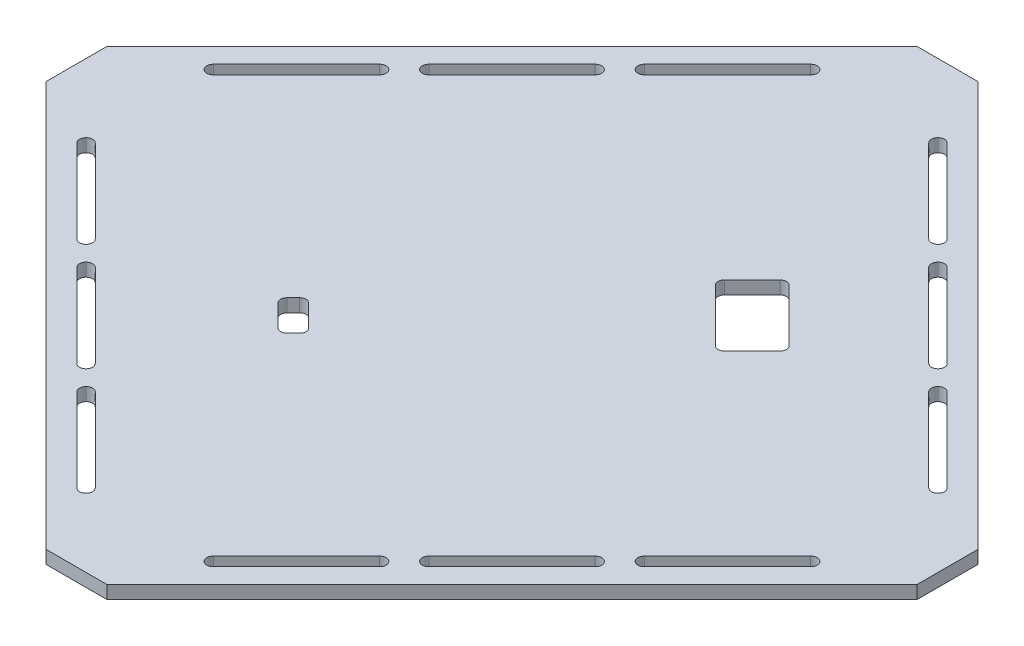
from build123d import *

# Parameters (mm, degrees)
MAIN_PLATE_DEPTH               = 3
BOTTOM_PLATE_CONNECTORS_DEPTH  = 22
REMOVE_STRESS_CONCENTRATIONS_R = 2.5
WIRE_HOLES_DEPTH               = 144.122325303
CUT_EXTRUDE1_DEPTH             = 144.614066163
FILLET1_R                      = 1.5


with BuildPart() as part:
    # Sketch1 → Main Plate (new body)
    with BuildSketch(Plane(origin=(0, 0, 0), x_dir=(1, 0, 0), z_dir=(0, 1, 0))):
        Polygon((-7, 100), (7, 100), (100, 7), (100, -7), (7, -100), (-7, -100), (-100, -7), (-100, 7), align=None)
    extrude(amount=MAIN_PLATE_DEPTH)

    # Sketch2 → Bottom Plate Connectors (add)
    with BuildSketch(Plane.XZ):
        Polygon((7.778174593, 16.970562748), (16.970562748, 7.778174593), (19.091883092, 9.899494937), (9.899494937, 19.091883092), align=None)
        Polygon((16.970562748, -7.778174593), (7.778174593, -16.970562748), (9.899494937, -19.091883092), (19.091883092, -9.899494937), align=None)
        Polygon((-7.778174593, -16.970562748), (-16.970562748, -7.778174593), (-19.091883092, -9.899494937), (-9.899494937, -19.091883092), align=None)
        Polygon((-16.970562748, 7.778174593), (-7.778174593, 16.970562748), (-9.899494937, 19.091883092), (-19.091883092, 9.899494937), align=None)
    extrude(amount=BOTTOM_PLATE_CONNECTORS_DEPTH)

    # Remove Stress Concentrations
    remove_stress_concentrations_edges = [part.edges().sort_by_distance(p)[0] for p in [
        (8.838834765, 0, 18.03122292),
        (18.03122292, 0, 8.838834765),
        (14.495689014, 0, 14.495689014),
        (18.03122292, 0, -8.838834765),
        (8.838834765, 0, -18.03122292),
        (14.495689014, 0, -14.495689014),
        (-8.838834765, 0, -18.03122292),
        (-18.03122292, 0, -8.838834765),
        (-14.495689014, 0, -14.495689014),
        (-18.03122292, 0, 8.838834765),
        (-8.838834765, 0, 18.03122292),
        (-14.495689014, 0, 14.495689014),
    ]]
    fillet(remove_stress_concentrations_edges, radius=REMOVE_STRESS_CONCENTRATIONS_R)

    # Sketch3 → Wire Holes (cut, through all)
    with BuildSketch(Plane.XZ):
        Polygon((30.405591591, -16.263455967), (38.890872965, -24.748737342), (24.748737342, -38.890872965), (16.263455967, -30.405591591), align=None)
        Polygon((-23.334523779, 30.405591591), (-19.798989873, 26.870057685), (-26.870057685, 19.798989873), (-30.405591591, 23.334523779), align=None)
    extrude(amount=-WIRE_HOLES_DEPTH, mode=Mode.SUBTRACT)

    # Sketch4 → Cut-Extrude1 (cut, through all)
    with BuildSketch(Plane(origin=(0, 3, 0), x_dir=(1, 0, 0), z_dir=(0, 1, 0))):
        Polygon((14.609127035, 85.319805153), (35.82233047, 64.106601718), (33.701010127, 61.985281374), (12.487806691, 83.19848481), align=None)
        Polygon((39.357864376, 60.571067812), (60.571067812, 39.357864376), (58.449747468, 37.236544033), (37.236544033, 58.449747468), align=None)
        Polygon((64.106601718, 35.82233047), (85.319805153, 14.609127035), (83.19848481, 12.487806691), (61.985281374, 33.701010127), align=None)
        Polygon((85.319805153, -14.609127035), (64.106601718, -35.82233047), (61.985281374, -33.701010127), (83.19848481, -12.487806691), align=None)
        Polygon((58.449747468, -37.236544033), (60.571067812, -39.357864376), (39.357864376, -60.571067812), (37.236544033, -58.449747468), align=None)
        Polygon((33.701010127, -61.985281374), (35.82233047, -64.106601718), (14.609127035, -85.319805153), (12.487806691, -83.19848481), align=None)
        Polygon((-14.609127035, -85.319805153), (-35.82233047, -64.106601718), (-33.701010127, -61.985281374), (-12.487806691, -83.19848481), align=None)
        Polygon((-37.236544033, -58.449747468), (-39.357864376, -60.571067812), (-60.571067812, -39.357864376), (-58.449747468, -37.236544033), align=None)
        Polygon((-61.985281374, -33.701010127), (-64.106601718, -35.82233047), (-85.319805153, -14.609127035), (-83.19848481, -12.487806691), align=None)
        Polygon((-85.319805153, 14.609127035), (-64.106601718, 35.82233047), (-61.985281374, 33.701010127), (-83.19848481, 12.487806691), align=None)
        Polygon((-58.449747468, 37.236544033), (-60.571067812, 39.357864376), (-39.357864376, 60.571067812), (-37.236544033, 58.449747468), align=None)
        Polygon((-33.701010127, 61.985281374), (-35.82233047, 64.106601718), (-14.609127035, 85.319805153), (-12.487806691, 83.19848481), align=None)
    extrude(amount=-CUT_EXTRUDE1_DEPTH, mode=Mode.SUBTRACT)

    # Fillet1
    fillet1_edges = [part.edges().sort_by_distance(p)[0] for p in [
        (16.263455967, 1.5, -30.405591591),
        (24.748737342, 1.5, -38.890872965),
        (30.405591591, 1.5, -16.263455967),
        (38.890872965, 1.5, -24.748737342),
        (-23.334523779, 1.5, 30.405591591),
        (-19.798989873, 1.5, 26.870057685),
        (-30.405591591, 1.5, 23.334523779),
        (-26.870057685, 1.5, 19.798989873),
        (-33.701010127, 1.5, 61.985281374),
        (-58.449747468, 1.5, 37.236544033),
        (-83.19848481, 1.5, 12.487806691),
        (-64.106601718, 1.5, -35.82233047),
        (-39.357864376, 1.5, -60.571067812),
        (-14.609127035, 1.5, -85.319805153),
        (14.609127035, 1.5, -85.319805153),
        (33.701010127, 1.5, 61.985281374),
        (58.449747468, 1.5, 37.236544033),
        (83.19848481, 1.5, 12.487806691),
        (39.357864376, 1.5, -60.571067812),
        (64.106601718, 1.5, -35.82233047),
        (-39.357864376, 1.5, 60.571067812),
        (-64.106601718, 1.5, 35.82233047),
        (-83.19848481, 1.5, -12.487806691),
        (-58.449747468, 1.5, -37.236544033),
        (-33.701010127, 1.5, -61.985281374),
        (33.701010127, 1.5, -61.985281374),
        (58.449747468, 1.5, -37.236544033),
        (83.19848481, 1.5, -12.487806691),
        (64.106601718, 1.5, 35.82233047),
        (-14.609127035, 1.5, 85.319805153),
        (39.357864376, 1.5, 60.571067812),
        (14.609127035, 1.5, 85.319805153),
        (-85.319805153, 1.5, 14.609127035),
        (-85.319805153, 1.5, -14.609127035),
        (-60.571067812, 1.5, -39.357864376),
        (-35.82233047, 1.5, -64.106601718),
        (-60.571067812, 1.5, 39.357864376),
        (-35.82233047, 1.5, 64.106601718),
        (12.487806691, 1.5, 83.19848481),
        (12.487806691, 1.5, -83.19848481),
        (-12.487806691, 1.5, 83.19848481),
        (-37.236544033, 1.5, 58.449747468),
        (-61.985281374, 1.5, 33.701010127),
        (-61.985281374, 1.5, -33.701010127),
        (-37.236544033, 1.5, -58.449747468),
        (-12.487806691, 1.5, -83.19848481),
        (35.82233047, 1.5, -64.106601718),
        (60.571067812, 1.5, -39.357864376),
        (85.319805153, 1.5, -14.609127035),
        (35.82233047, 1.5, 64.106601718),
        (60.571067812, 1.5, 39.357864376),
        (85.319805153, 1.5, 14.609127035),
        (37.236544033, 1.5, 58.449747468),
        (61.985281374, 1.5, 33.701010127),
        (37.236544033, 1.5, -58.449747468),
        (61.985281374, 1.5, -33.701010127),
    ]]
    fillet(fillet1_edges, radius=FILLET1_R - 0.0001)  # a hair under: the kernel refuses the full size


solid = part.part
